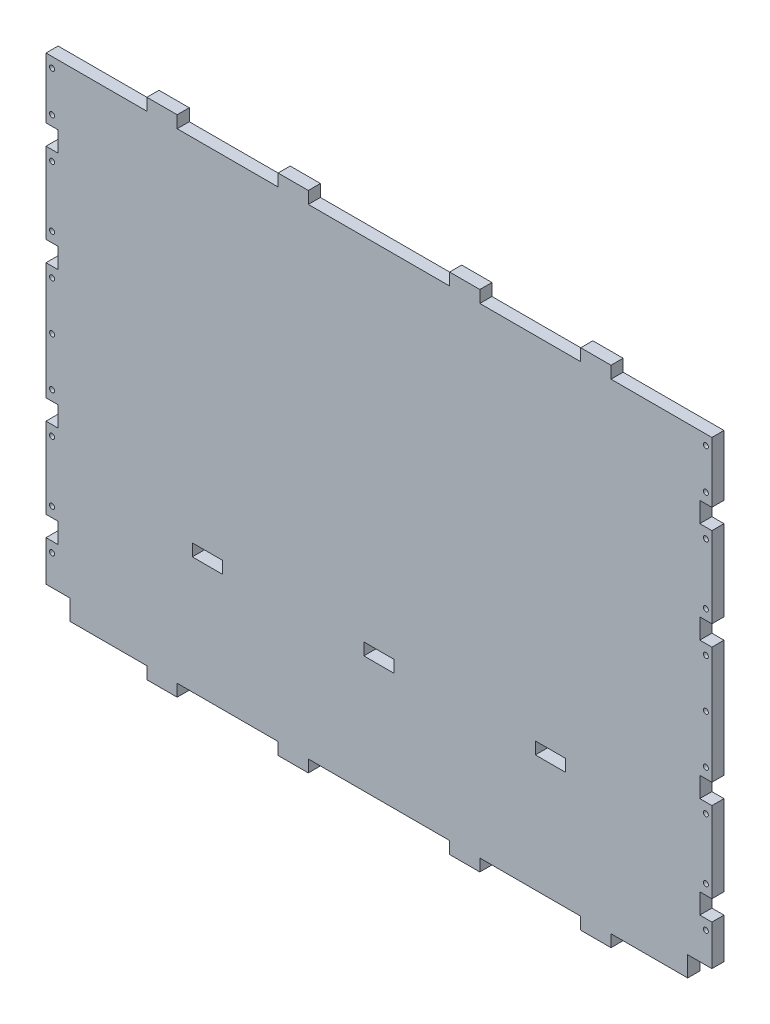
from build123d import *

# Parameters (mm, degrees)
ESQUISSE1_W             = 330
ESQUISSE1_H             = 238
ESQUISSE1_W_2           = 15
ESQUISSE1_H_2           = 6
BOSS_EXTRU_1_DEPTH      = 6
ESQUISSE2_W             = 15
ESQUISSE2_H             = 6
BOSS_EXTRU_2_DEPTH      = 6
ESQUISSE3_W             = 6
ESQUISSE3_H             = 10
ESQUISSE3_W_2           = 12
ENL_V_MAT_EXTRU_1_DEPTH = 6
ESQUISSE4_R             = 1.25
ENL_V_MAT_EXTRU_2_DEPTH = 6


with BuildPart() as part:
    # Esquisse1 → Boss.-Extru.1 (new body)
    with BuildSketch(Plane.XY):
        Rectangle(ESQUISSE1_W, ESQUISSE1_H)
        with Locations((-85, -58)):
            Rectangle(ESQUISSE1_W_2, ESQUISSE1_H_2, mode=Mode.SUBTRACT)
        with Locations((0, -58)):
            Rectangle(ESQUISSE1_W_2, ESQUISSE1_H_2, mode=Mode.SUBTRACT)
        with Locations((85, -58)):
            Rectangle(ESQUISSE1_W_2, ESQUISSE1_H_2, mode=Mode.SUBTRACT)
    extrude(amount=BOSS_EXTRU_1_DEPTH)

    # Esquisse2 → Boss.-Extru.2 (add)
    with BuildSketch(Plane.XY.offset(6)):
        with Locations((-107.5, 122)):
            Rectangle(ESQUISSE2_W, ESQUISSE2_H)
        with Locations((107.5, 122)):
            Rectangle(ESQUISSE2_W, ESQUISSE2_H)
        with Locations((42.5, 122)):
            Rectangle(ESQUISSE2_W, ESQUISSE2_H)
        with Locations((-42.5, 122)):
            Rectangle(ESQUISSE2_W, ESQUISSE2_H)
        with Locations((107.5, -122)):
            Rectangle(ESQUISSE2_W, ESQUISSE2_H)
        with Locations((-107.5, -122)):
            Rectangle(ESQUISSE2_W, ESQUISSE2_H)
        with Locations((-42.5, -122)):
            Rectangle(ESQUISSE2_W, ESQUISSE2_H)
        with Locations((42.5, -122)):
            Rectangle(ESQUISSE2_W, ESQUISSE2_H)
    extrude(amount=-BOSS_EXTRU_2_DEPTH)

    # Esquisse3 → Enlèv. mat.-Extru.1 (cut)
    with BuildSketch(Plane.XY.offset(6)):
        with Locations((-162, 84)):
            Rectangle(ESQUISSE3_W, ESQUISSE3_H)
        with Locations((-162, 34)):
            Rectangle(ESQUISSE3_W, ESQUISSE3_H)
        with Locations((-162, -34)):
            Rectangle(ESQUISSE3_W, ESQUISSE3_H)
        with Locations((-162, -84)):
            Rectangle(ESQUISSE3_W, ESQUISSE3_H)
        with Locations((162, -84)):
            Rectangle(ESQUISSE3_W, ESQUISSE3_H)
        with Locations((162, -34)):
            Rectangle(ESQUISSE3_W, ESQUISSE3_H)
        with Locations((162, 34)):
            Rectangle(ESQUISSE3_W, ESQUISSE3_H)
        with Locations((162, 84)):
            Rectangle(ESQUISSE3_W, ESQUISSE3_H)
        with Locations((159, -114)):
            Rectangle(ESQUISSE3_W_2, ESQUISSE3_H)
        with Locations((-159, -114)):
            Rectangle(ESQUISSE3_W_2, ESQUISSE3_H)
    extrude(amount=-ENL_V_MAT_EXTRU_1_DEPTH, mode=Mode.SUBTRACT)

    # Esquisse4 → Enlèv. mat.-Extru.2 (cut)
    with BuildSketch(Plane.XY.offset(6)):
        with Locations((-162, 114)):
            Circle(ESQUISSE4_R)
        with Locations((-162, 94)):
            Circle(ESQUISSE4_R)
        with Locations((-162, 74)):
            Circle(ESQUISSE4_R)
        with Locations((-162, 44)):
            Circle(ESQUISSE4_R)
        with Locations((-162, 24)):
            Circle(ESQUISSE4_R)
        with Locations((-162, 0)):
            Circle(ESQUISSE4_R)
        with Locations((-162, -24)):
            Circle(ESQUISSE4_R)
        with Locations((-162, -44)):
            Circle(ESQUISSE4_R)
        with Locations((-162, -74)):
            Circle(ESQUISSE4_R)
        with Locations((-162, -94)):
            Circle(ESQUISSE4_R)
        with Locations((162, -94)):
            Circle(ESQUISSE4_R)
        with Locations((162, -74)):
            Circle(ESQUISSE4_R)
        with Locations((162, -44)):
            Circle(ESQUISSE4_R)
        with Locations((162, -24)):
            Circle(ESQUISSE4_R)
        with Locations((162, 0)):
            Circle(ESQUISSE4_R)
        with Locations((162, 24)):
            Circle(ESQUISSE4_R)
        with Locations((162, 44)):
            Circle(ESQUISSE4_R)
        with Locations((162, 74)):
            Circle(ESQUISSE4_R)
        with Locations((162, 94)):
            Circle(ESQUISSE4_R)
        with Locations((162, 114)):
            Circle(ESQUISSE4_R)
    extrude(amount=-ENL_V_MAT_EXTRU_2_DEPTH, mode=Mode.SUBTRACT)


solid = part.part
